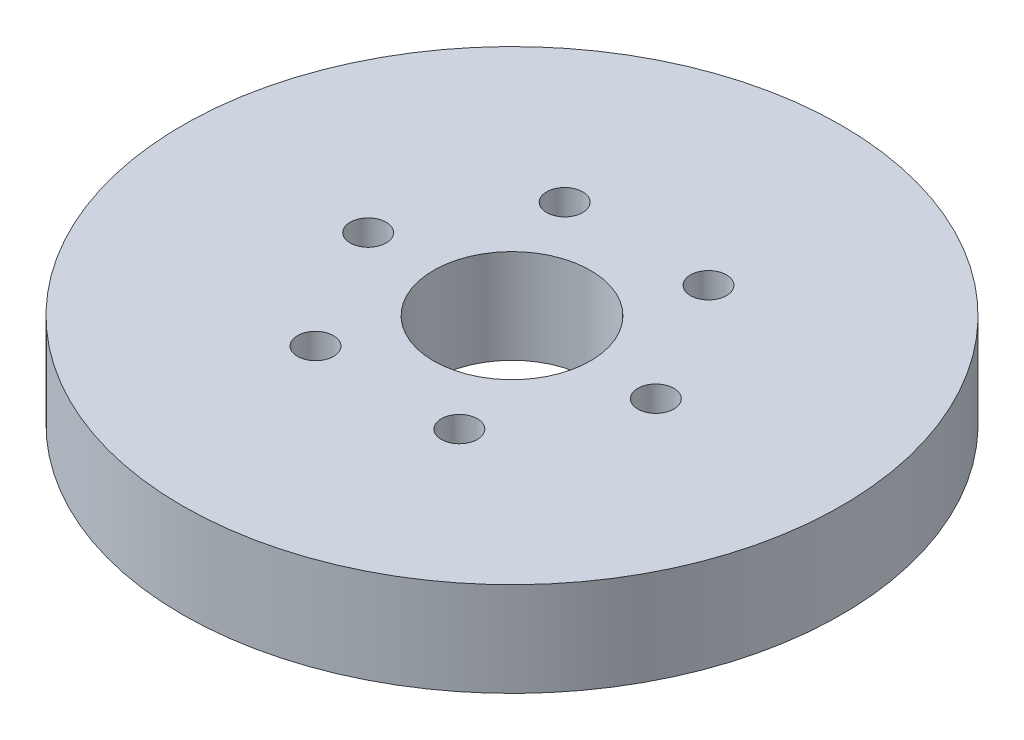
from build123d import *

# Parameters (mm, degrees)
SKETCH1_R           = 52.5
BOSS_EXTRUDE1_DEPTH = 15
SKETCH2_R           = 12.5
CUT_EXTRUDE1_DEPTH  = 76.746287038
SKETCH3_R           = 2.868901353
CUT_EXTRUDE2_DEPTH  = 14.003451283
CIRPATTERN1_COUNT   = 6


with BuildPart() as part:
    # Sketch1 → Boss-Extrude1 (new body)
    with BuildSketch(Plane(origin=(0, 0, 0), x_dir=(1, 0, 0), z_dir=(0, 1, 0))):
        Circle(SKETCH1_R)
    extrude(amount=BOSS_EXTRUDE1_DEPTH)

    # Sketch2 → Cut-Extrude1 (cut, through all)
    with BuildSketch(Plane(origin=(0, 0, 0), x_dir=(1, 0, 0), z_dir=(0, 1, 0))):
        Circle(SKETCH2_R)
    extrude(amount=CUT_EXTRUDE1_DEPTH, mode=Mode.SUBTRACT)

    # Sketch3 → Cut-Extrude2 (cut)
    with BuildSketch(Plane(origin=(0, 15, 0), x_dir=(1, 0, 0), z_dir=(0, 1, 0))):
        with Locations((-22.913471565, 0)):
            Circle(SKETCH3_R)
    cut_extrude2 = extrude(amount=-CUT_EXTRUDE2_DEPTH, mode=Mode.SUBTRACT)

    # CirPattern1: Cut-Extrude2 ×6 about axis
    cirpattern1_axis = Axis((0, 0, 0), (0, 1, 0))
    for i in range(1, CIRPATTERN1_COUNT):
        add(cut_extrude2.rotate(cirpattern1_axis, i * 360 / CIRPATTERN1_COUNT), mode=Mode.SUBTRACT)


solid = part.part
